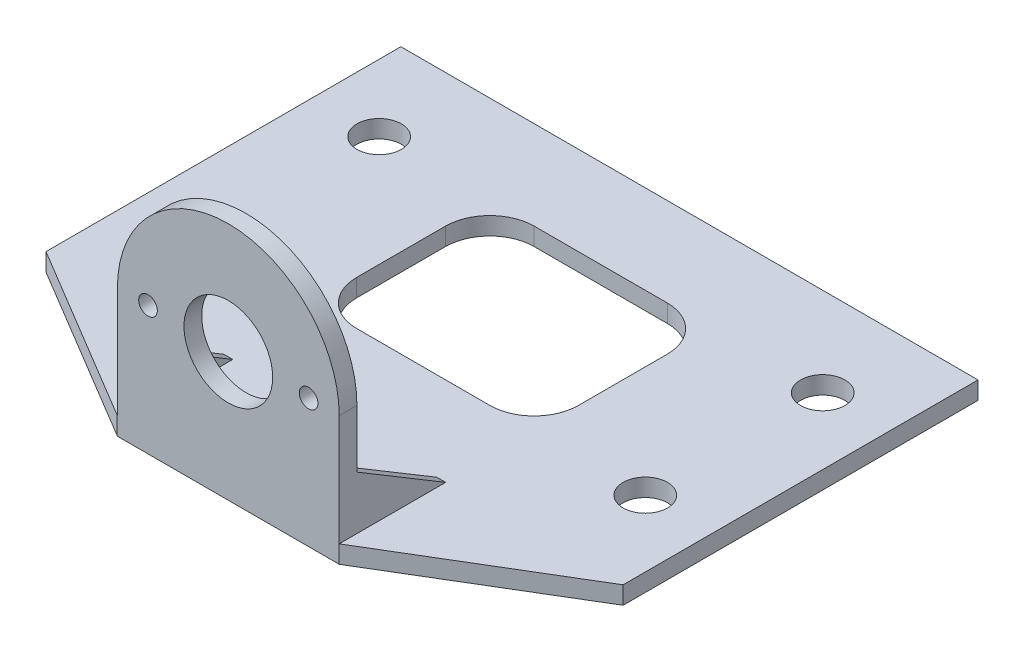
from build123d import *

# Parameters (mm, degrees)
SKETCH1_R                = 12.5
SKETCH1_R_2              = 1.05
SKETCH1_R_3              = 5
BOSS_EXTRUDE1_DEPTH      = 2
BOSS_EXTRUDE5_START      = -2
BOSS_EXTRUDE5_DEPTH      = 2
BOSS_EXTRUDE6_DEPTH      = 50
BOSS_EXTRUDE6_DEPTH_BACK = 2
SKETCH9_W                = 25.04914064
SKETCH9_H                = 2
BOSS_EXTRUDE7_DEPTH      = 2
SKETCH13_R               = 2.5
CUT_EXTRUDE1_DEPTH       = 7
SKETCH15_W               = 1
SKETCH15_H               = 6
BOSS_EXTRUDE8_DEPTH      = 10
CUT_EXTRUDE2_START       = -1
CUT_EXTRUDE2_DEPTH       = 25
CUT_EXTRUDE3_DEPTH       = 5


# Read off the part's stored shape, not the designer's step: Cut-Extrude2
with BuildPart() as part:
    # Sketch1 → Boss-Extrude1 (new body)
    with BuildSketch(Plane.XY):
        Circle(SKETCH1_R)
        with Locations((-9.05, 0)):
            Circle(SKETCH1_R_2, mode=Mode.SUBTRACT)
        with Locations((9.05, 0)):
            Circle(SKETCH1_R_2, mode=Mode.SUBTRACT)
        Circle(SKETCH1_R_3, mode=Mode.SUBTRACT)
    extrude(amount=BOSS_EXTRUDE1_DEPTH)

    # Sketch2 → Boss-Extrude5 (add)
    with BuildSketch(Plane.XY.offset(2).offset(BOSS_EXTRUDE5_START)):
        with BuildLine():
            ThreePointArc((12.5, 0), (8.838834759, -8.838834771), (-1.6e-08, -12.5))
            Line((-1.6e-08, -12.5), (12.5, -12.5))
            Line((12.5, -12.5), (12.5, 0))
        make_face()
        with BuildLine():
            ThreePointArc((-1.6e-08, -12.5), (-8.838834771, -8.838834759), (-12.5, 0))
            Line((-12.5, 0), (-12.5, -12.5))
            Line((-12.5, -12.5), (-1.6e-08, -12.5))
        make_face()
    extrude(amount=BOSS_EXTRUDE5_DEPTH)

    # Sketch9 → Boss-Extrude6 (add, two sides: drawn at the far end of the back side and taken through both)
    with BuildSketch(Plane(origin=(0, 0, 0), x_dir=(-1, 0, 0), z_dir=(0, 0, -1)).offset(-BOSS_EXTRUDE6_DEPTH_BACK)):
        with Locations((0.02457032, -13.5)):
            Rectangle(SKETCH9_W, SKETCH9_H)
    extrude(amount=BOSS_EXTRUDE6_DEPTH + BOSS_EXTRUDE6_DEPTH_BACK)

    # Sketch12 → Boss-Extrude7 (add)
    with BuildSketch(Plane(origin=(0, -12.5, 0), x_dir=(1, 0, 0), z_dir=(0, 1, 0))):
        Polygon((-12.54914064, 50), (-32.54914064, 50), (-32.54914064, 10), (-12.5, -2), (-12.54914064, 0), align=None)
        Polygon((12.5, 50), (32.5, 50), (32.5, 10), (12.5, -2), (12.5, 0), align=None)
    extrude(amount=-BOSS_EXTRUDE7_DEPTH)

    # Sketch13 → Cut-Extrude1 (cut)
    with BuildSketch(Plane(origin=(0, -12.5, 0), x_dir=(1, 0, 0), z_dir=(0, 1, 0))):
        with Locations(Location((-25, 20, 0), (0, 0, 270))):
            Circle(SKETCH13_R)
        with Locations(Location((-25, 40, 0), (0, 0, 270))):
            Circle(SKETCH13_R)
        with Locations(Location((25, 40, 0), (0, 0, 90))):
            Circle(SKETCH13_R)
        with Locations(Location((25, 20, 0), (0, 0, 90))):
            Circle(SKETCH13_R)
    extrude(amount=-CUT_EXTRUDE1_DEPTH, mode=Mode.SUBTRACT)

    # Sketch15 → Boss-Extrude8 (add)
    with BuildSketch(Plane(origin=(0, 0, 0), x_dir=(-1, 0, 0), z_dir=(0, 0, -1))):
        with Locations((12, -9.5)):
            Rectangle(SKETCH15_W, SKETCH15_H)
        with Locations((-12, -9.5)):
            Rectangle(SKETCH15_W, SKETCH15_H)
    extrude(amount=BOSS_EXTRUDE8_DEPTH)

    # Cut-Extrude2 outline → Cut-Extrude2 (cut)
    with BuildSketch(Plane(origin=(-11.5, 0, 0), x_dir=(0, 0, -1), z_dir=(1, 0, 0)).offset(CUT_EXTRUDE2_START)):
        Polygon((10, -6.5), (0, -6.5), (10, -12.5), align=None)
    extrude(amount=CUT_EXTRUDE2_DEPTH, mode=Mode.SUBTRACT)

    # Sketch17 → Cut-Extrude3 (cut)
    with BuildSketch(Plane(origin=(0, -12.5, 0), x_dir=(1, 0, 0), z_dir=(0, 1, 0))):
        with BuildLine():
            Line((7.47542968, 40), (-7.52457032, 40))
            ThreePointArc((-7.52457032, 40), (-11.060104226, 38.535533906), (-12.52457032, 35))
            Line((-12.52457032, 35), (-12.52457032, 25))
            ThreePointArc((-12.52457032, 25), (-11.060104226, 21.464466094), (-7.52457032, 20))
            Line((-7.52457032, 20), (7.47542968, 20))
            ThreePointArc((7.47542968, 20), (11.010963586, 21.464466094), (12.47542968, 25))
            Line((12.47542968, 25), (12.47542968, 35))
            ThreePointArc((12.47542968, 35), (11.010963586, 38.535533906), (7.47542968, 40))
        make_face()
    extrude(amount=-CUT_EXTRUDE3_DEPTH, mode=Mode.SUBTRACT)


solid = part.part
